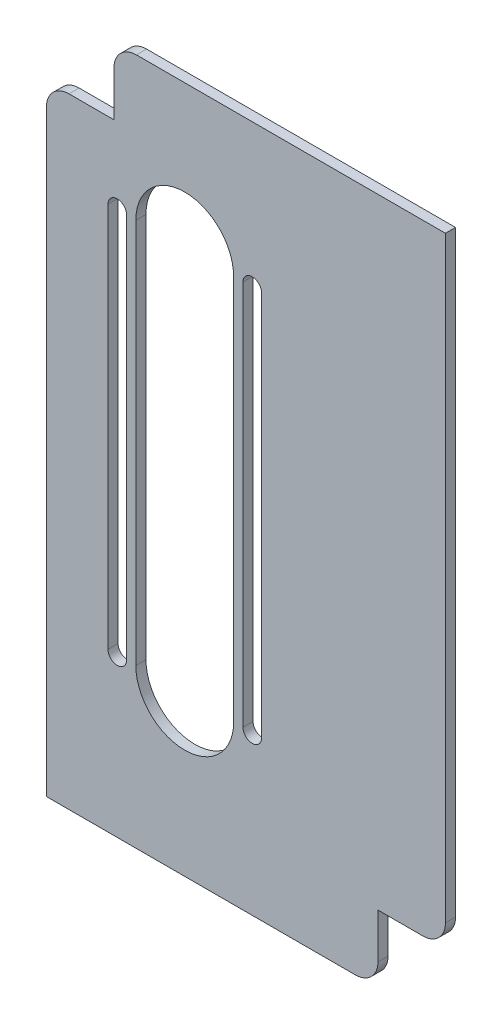
from build123d import *

# Parameters (mm, degrees)
SKETCH1_W           = 118.275
SKETCH1_H           = 203.74
BOSS_EXTRUDE1_DEPTH = 3
CUT_EXTRUDE1_DEPTH  = 3
SKETCH3_W           = 20
SKETCH3_H           = 20
CUT_EXTRUDE2_DEPTH  = 10
FILLET1_R           = 6.7


with BuildPart() as part:
    # Sketch1 → Boss-Extrude1 (new body)
    with BuildSketch(Plane.XY):
        with Locations((59.1375, 101.87)):
            Rectangle(SKETCH1_W, SKETCH1_H)
    extrude(amount=BOSS_EXTRUDE1_DEPTH)

    # Sketch2 → Cut-Extrude1 (cut)
    with BuildSketch(Plane.XY.offset(3)):
        with BuildLine():
            Line((55.5, 161.195926995), (55.5, 46.904073005))
            ThreePointArc((55.5, 46.904073005), (41, 32.404073005), (26.5, 46.904073005))
            Line((26.5, 46.904073005), (26.5, 161.195926995))
            ThreePointArc((26.5, 161.195926995), (41, 175.695926995), (55.5, 161.195926995))
        make_face()
        with BuildLine():
            Line((63.75, 161.195926995), (63.75, 46.904073005))
            ThreePointArc((63.75, 46.904073005), (61, 44.154073005), (58.25, 46.904073005))
            Line((58.25, 46.904073005), (58.25, 161.195926995))
            ThreePointArc((58.25, 161.195926995), (61, 163.945926995), (63.75, 161.195926995))
        make_face()
        with BuildLine():
            Line((23.75, 161.195926995), (23.75, 46.904073005))
            ThreePointArc((23.75, 46.904073005), (21, 44.154073005), (18.25, 46.904073005))
            Line((18.25, 46.904073005), (18.25, 161.195926995))
            ThreePointArc((18.25, 161.195926995), (21, 163.945926995), (23.75, 161.195926995))
        make_face()
    extrude(amount=-CUT_EXTRUDE1_DEPTH, mode=Mode.SUBTRACT)

    # Sketch3 → Cut-Extrude2 (cut)
    with BuildSketch(Plane.XY.offset(3)):
        with Locations((10, 193.74)):
            Rectangle(SKETCH3_W, SKETCH3_H)
        with Locations((108.275, 10)):
            Rectangle(SKETCH3_W, SKETCH3_H)
    extrude(amount=-CUT_EXTRUDE2_DEPTH, mode=Mode.SUBTRACT)

    # Fillet1
    fillet1_edges = [part.edges().sort_by_distance(p)[0] for p in [
        (98.275, 0, 1.5),
        (118.275, 20, 1.5),
        (20, 203.74, 1.5),
        (0, 183.74, 1.5),
    ]]
    fillet(fillet1_edges, radius=FILLET1_R)


solid = part.part
